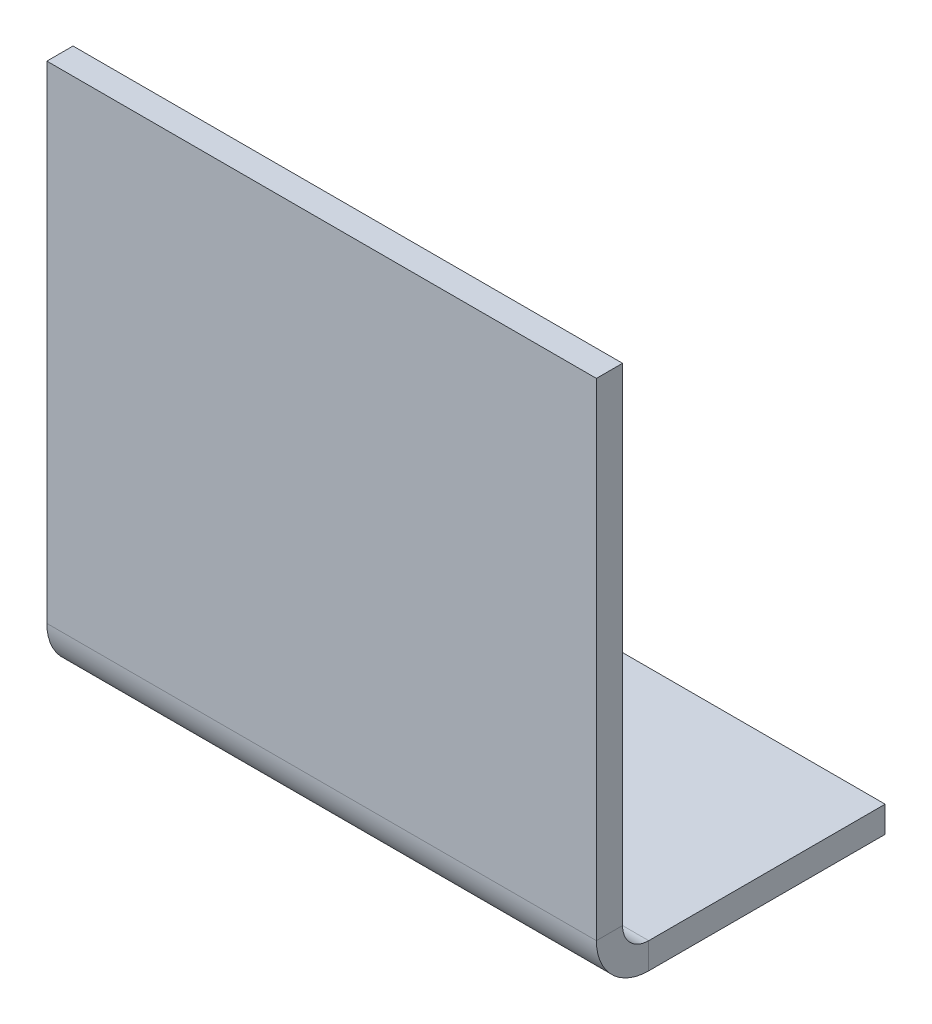
from build123d import *

# Parameters (mm, degrees)
SKETCH1_W              = 42
SKETCH1_H              = 60
SKETCH1_R              = 3.5
BASE_FLANGE2_DEPTH     = 2
SKETCHED_BEND1_DEPTH   = 42
SKETCHED_BEND1_2_DEPTH = 42


# Read off the part's stored shape, not the designer's step: Sketched Bend1
# Sheet-metal steps are written as plain solids
with BuildPart() as part:
    # Sketch1 → Base-Flange2 (new body)
    with BuildSketch(Plane(origin=(0, 0, 0), x_dir=(1, 0, 0), z_dir=(0, 1, 0))):
        with Locations((21, -30)):
            Rectangle(SKETCH1_W, SKETCH1_H)
        with Locations(Location((21, -10, 0), (0, 0, 270))):
            Circle(SKETCH1_R, mode=Mode.SUBTRACT)
    extrude(amount=-BASE_FLANGE2_DEPTH)

    # Sketched Bend1 outline → Sketched Bend1 (cut)
    with BuildSketch(Plane.YZ):
        with BuildLine():
            ThreePointArc((-2, 18.07), (-1.464101615, 20.07), (0, 21.534101616))
            Line((0, 21.534101616), (0, 60))
            Line((0, 60), (-2, 60))
            Line((-2, 60), (-2, 18.07))
        make_face()
    extrude(amount=SKETCHED_BEND1_DEPTH, mode=Mode.SUBTRACT)

    # Sketched Bend1 2 outline → Sketched Bend1 2 (add)
    with BuildSketch(Plane.YZ):
        with BuildLine():
            ThreePointArc((0, 18.07), (0.585786438, 19.484213562), (2, 20.07))
            Line((2, 20.07), (39.21761102, 20.07))
            Line((39.21761102, 20.07), (39.21761102, 22.07))
            Line((39.21761102, 22.07), (2, 22.07))
            ThreePointArc((2, 22.07), (0.96472382, 21.933703305), (0, 21.534101616))
            Line((0, 21.534101616), (0, 18.07))
        make_face()
    extrude(amount=SKETCHED_BEND1_2_DEPTH)


solid = part.part
